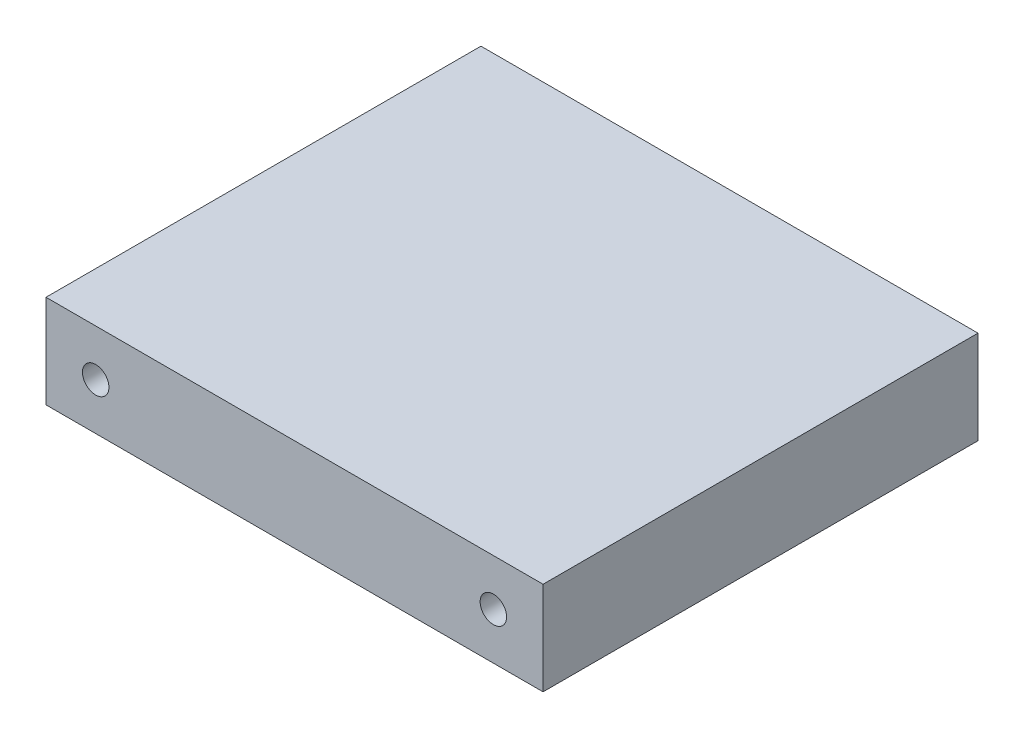
from build123d import *

# Parameters (mm, degrees)
SKETCH2_W                 = 50.8
SKETCH2_H                 = 44.45
BOSS_EXTRUDE1_DEPTH       = 9.525
F_6_32_TAPPED_HOLE1_D     = 2.7051
F_6_32_TAPPED_HOLE1_DEPTH = 9.398
F_6_32_TAPPED_HOLE1_TIP   = 0.81269403
F_6_32_TAPPED_HOLE2_D     = 2.7051
F_6_32_TAPPED_HOLE2_DEPTH = 9.398
F_6_32_TAPPED_HOLE2_TIP   = 0.81269403


with BuildPart() as part:
    # Sketch2 → Boss-Extrude1 (new body)
    with BuildSketch(Plane(origin=(0, 0, 0), x_dir=(1, 0, 0), z_dir=(0, 1, 0))):
        Rectangle(SKETCH2_W, SKETCH2_H)
    extrude(amount=BOSS_EXTRUDE1_DEPTH)

    # #6-32 Tapped Hole1
    with Locations(Plane.XY.offset(22.225)):
        with Locations((-20.32, 4.7625), (20.32, 4.7625)):
            Hole(F_6_32_TAPPED_HOLE1_D / 2, depth=F_6_32_TAPPED_HOLE1_DEPTH)
            with Locations((0, 0, -(F_6_32_TAPPED_HOLE1_DEPTH + F_6_32_TAPPED_HOLE1_TIP / 2))):  # 118° drill point
                Cone(0, F_6_32_TAPPED_HOLE1_D / 2, F_6_32_TAPPED_HOLE1_TIP, mode=Mode.SUBTRACT)

    # #6-32 Tapped Hole2
    with Locations(Plane(origin=(0, 0, -22.225), x_dir=(-1, 0, 0), z_dir=(0, 0, -1))):
        with Locations((-20.32, 4.7625), (20.32, 4.7625)):
            Hole(F_6_32_TAPPED_HOLE2_D / 2, depth=F_6_32_TAPPED_HOLE2_DEPTH)
            with Locations((0, 0, -(F_6_32_TAPPED_HOLE2_DEPTH + F_6_32_TAPPED_HOLE2_TIP / 2))):  # 118° drill point
                Cone(0, F_6_32_TAPPED_HOLE2_D / 2, F_6_32_TAPPED_HOLE2_TIP, mode=Mode.SUBTRACT)


solid = part.part
